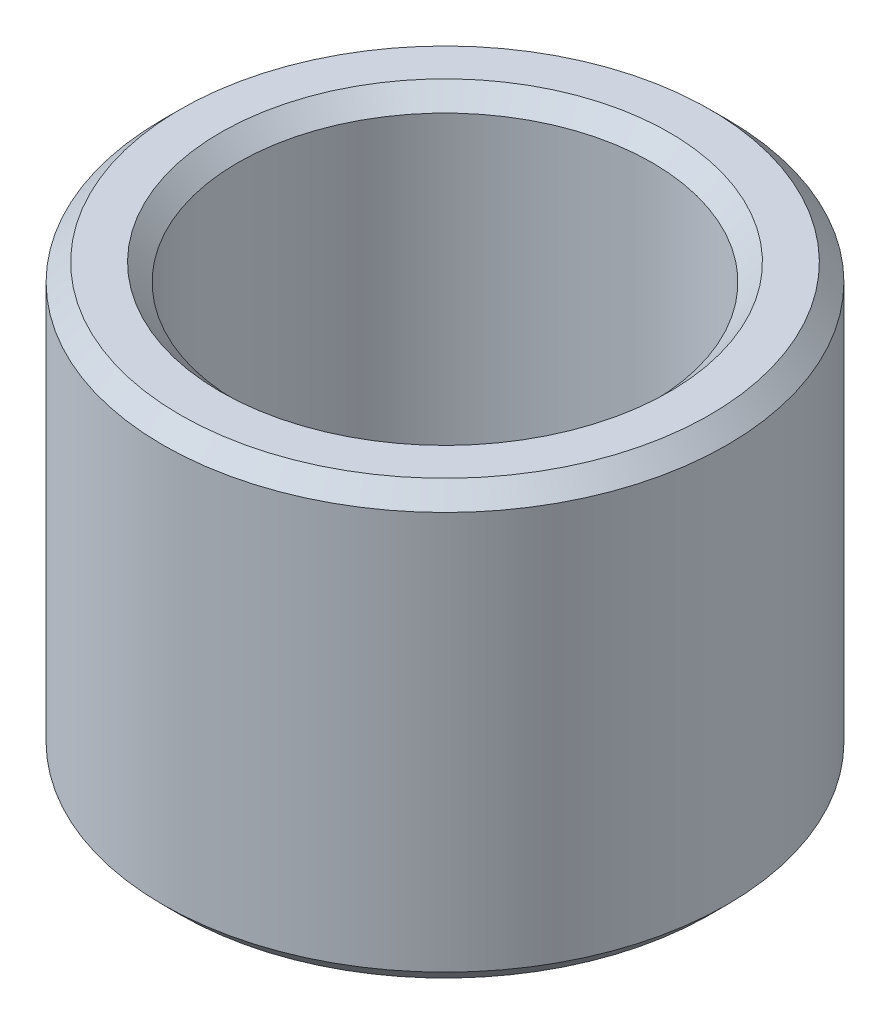
from build123d import *

# Parameters (mm, degrees)
SKETCH1_R           = 10
BOSS_EXTRUDE1_DEPTH = 15.344244191
SKETCH2_R           = 7.342873373
CUT_EXTRUDE1_DEPTH  = 21.867338829
CHAMFER1_SIZE       = 0.615494625


with BuildPart() as part:
    # Sketch1 → Boss-Extrude1 (new body)
    with BuildSketch(Plane(origin=(0, 0, 0), x_dir=(1, 0, 0), z_dir=(0, 1, 0))):
        Circle(SKETCH1_R)
    extrude(amount=BOSS_EXTRUDE1_DEPTH)

    # Sketch2 → Cut-Extrude1 (cut, through all)
    with BuildSketch(Plane(origin=(0, 0, 0), x_dir=(1, 0, 0), z_dir=(0, 1, 0))):
        Circle(SKETCH2_R)
    extrude(amount=CUT_EXTRUDE1_DEPTH, mode=Mode.SUBTRACT)

    # Chamfer1
    chamfer1_edges = [part.edges().sort_by_distance(p)[0] for p in [
        (-7.342873373, 15.344244191, 0),
        (-7.342873373, 0, 0),
        (-10, 0, 0),
        (-10, 15.344244191, 0),
    ]]
    chamfer(chamfer1_edges, length=CHAMFER1_SIZE)


solid = part.part
